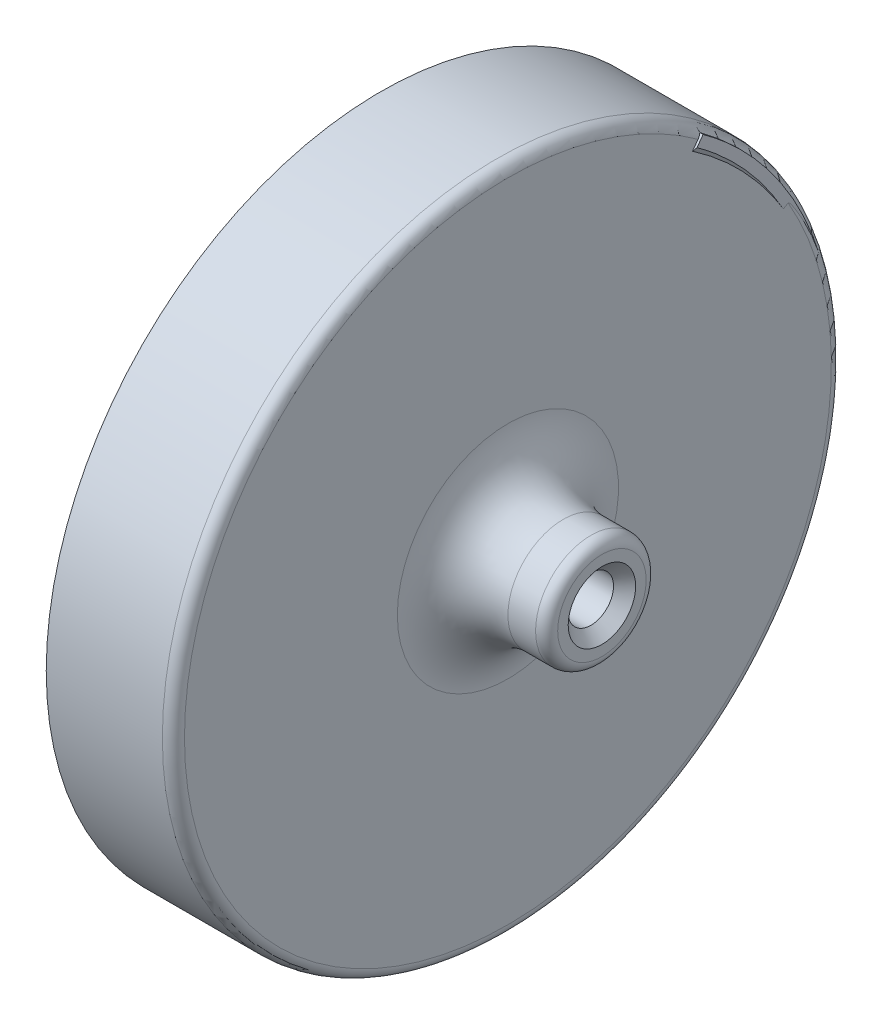
from build123d import *

# Parameters (mm, degrees)
SWEEP1_PITCH       = 6
SKETCH4_R          = 60.5
CUT_EXTRUDE1_DEPTH = 95.448398738


with BuildPart() as part:
    # Sketch1 → Revolve1 (revolve)
    with BuildSketch(Plane.XY, mode=Mode.PRIVATE) as revolve1_sk:
        with BuildLine():
            Line((0, 60.5), (21, 60.5))
            ThreePointArc((21, 60.5), (22.414213562, 59.914213562), (23, 58.5))
            Line((23, 58.5), (23, 20))
            ThreePointArc((23, 20), (25.928932188, 12.928932188), (33, 10))
            Line((33, 10), (38, 10))
            ThreePointArc((38, 10), (39.414213562, 9.414213562), (40, 8))
            Line((40, 8), (40, 6.1))
            Line((40, 6.1), (38, 4.1))
            Line((38, 4.1), (22, 4.1))
            Line((22, 4.1), (20, 6.1))
            Line((20, 6.1), (20, 55.5))
            ThreePointArc((20, 55.5), (19.414213562, 56.914213562), (18, 57.5))
            Line((18, 57.5), (0, 57.5))
            Line((0, 57.5), (0, 60.5))
        make_face()
    revolve(revolve1_sk.sketch.rotate(Axis((0, 0, 0), (1, 0, 0)), 90), axis=Axis((0, 0, 0), (1, 0, 0)))

    # Sweep1: arcs per turn and ends read off the stored shape
    # Sweep1: the profile of Sketch3 screwed along a right-hand helix through 3.900003 turns, 14 arcs to a turn; built about Z, then put on its axis
    sweep1_z = Axis((0, 0, 0), (0, 0, 1))
    sweep1_corners = [(-57.499999991, 0.001033671, -1.7167e-05), (-53.777052649, 0.000966744, -2.149461817), (-53.777052649, 0.000966744, -3.650572517), (-57.499999991, 0.001033671, -5.800017167), (-59.365618697, 0.001067209, -5.800017167), (-59.365618697, 0.001067209, -1.7167e-05)]
    with BuildLine(mode=Mode.PRIVATE) as sweep1_profile:
        Line(sweep1_corners[0], sweep1_corners[1])
        Line(sweep1_corners[1], sweep1_corners[2])
        Line(sweep1_corners[2], sweep1_corners[3])
        Line(sweep1_corners[3], sweep1_corners[4])
        Line(sweep1_corners[4], sweep1_corners[5])
        Line(sweep1_corners[5], sweep1_corners[0])
    sweep1_cap = Face(sweep1_profile.wire())
    sweep1_turn_angles = [0, 12.857142857, 25.714285714, 38.571428571, 51.428571429, 64.285714286, 77.142857143, 90, 102.857142857, 115.714285714, 128.571428571, 141.428571429, 154.285714286, 167.142857143, 180, 192.857142857, 205.714285714, 218.571428571, 231.428571429, 244.285714286, 257.142857143, 270, 282.857142857, 295.714285714, 308.571428571, 321.428571429, 334.285714286, 347.142857143, 360]
    sweep1_turn_weights = [1, 0.9749279121818236, 1, 0.9749279121818236, 1, 0.9749279121818236, 1, 0.9749279121818236, 1, 0.9749279121818236, 1, 0.9749279121818236, 1, 0.9749279121818236, 1, 0.9749279121818236, 1, 0.9749279121818236, 1, 0.9749279121818236, 1, 0.9749279121818236, 1, 0.9749279121818237, 1, 0.9749279121818236, 1, 0.9749279121818236, 1]
    sweep1_turn_rails = [Edge.make_bspline([Vector(p[0], p[1], 0).rotate(sweep1_z, sweep1_turn_angles[k]) / sweep1_turn_weights[k] + Vector(0, 0, p[2] + SWEEP1_PITCH * sweep1_turn_angles[k] / 360) for k in range(29)], [0, 0, 0, 1, 1, 2, 2, 3, 3, 4, 4, 5, 5, 6, 6, 7, 7, 8, 8, 9, 9, 10, 10, 11, 11, 12, 12, 13, 13, 14, 14, 14], 2, sweep1_turn_weights) for p in sweep1_corners]
    sweep1_turn_sides = [Face.make_surface_from_curves(sweep1_turn_rails[p[0]], sweep1_turn_rails[p[1]]) for p in [(0, 1), (1, 2), (2, 3), (3, 4), (4, 5), (5, 0)]]
    sweep1_last_angles = [1080, 1092.857142857, 1105.714285714, 1118.571428571, 1131.428571429, 1144.285714286, 1157.142857143, 1170, 1182.857142857, 1195.714285714, 1208.571428571, 1221.428571429, 1234.285714286, 1247.142857143, 1260, 1272.857142857, 1285.714285714, 1298.571428571, 1311.428571429, 1324.285714286, 1337.142857143, 1350, 1362.857142857, 1375.714285714, 1388.571428571, 1396.286214286, 1404.001]
    sweep1_last_weights = [1, 0.9749279121818235, 1, 0.974927912181824, 1, 0.9749279121818235, 1, 0.9749279121818235, 1, 0.9749279121818235, 1, 0.974927912181824, 1, 0.9749279121818235, 1, 0.9749279121818235, 1, 0.9749279121818235, 1, 0.974927912181824, 1, 0.9749279121818235, 1, 0.974927912181824, 1, 0.990948590323975, 1]
    sweep1_last_rails = [Edge.make_bspline([Vector(p[0], p[1], 0).rotate(sweep1_z, sweep1_last_angles[k]) / sweep1_last_weights[k] + Vector(0, 0, p[2] + SWEEP1_PITCH * sweep1_last_angles[k] / 360) for k in range(27)], [0, 0, 0, 1, 1, 2, 2, 3, 3, 4, 4, 5, 5, 6, 6, 7, 7, 8, 8, 9, 9, 10, 10, 11, 11, 12, 12, 13, 13, 13], 2, sweep1_last_weights) for p in sweep1_corners]
    sweep1_last_sides = [Face.make_surface_from_curves(sweep1_last_rails[p[0]], sweep1_last_rails[p[1]]) for p in [(0, 1), (1, 2), (2, 3), (3, 4), (4, 5), (5, 0)]]
    sweep1 = Plane(origin=(0, 0, 0), x_dir=(0, -1, 0), z_dir=(1, 0, 0)) * Solid(Shell([*[p.moved(Location((0, 0, SWEEP1_PITCH * i))) for i in range(3) for p in sweep1_turn_sides], *sweep1_last_sides, sweep1_cap, sweep1_cap.rotate(sweep1_z, 1404.001).moved(Location((0, 0, SWEEP1_PITCH * 1404.001 / 360)))]))
    add(sweep1)

    # Sketch4 → Cut-Extrude1 (cut, through all)
    with BuildSketch(Plane.ZY):
        Circle(SKETCH4_R)
    extrude(amount=CUT_EXTRUDE1_DEPTH, mode=Mode.SUBTRACT)


solid = part.part
